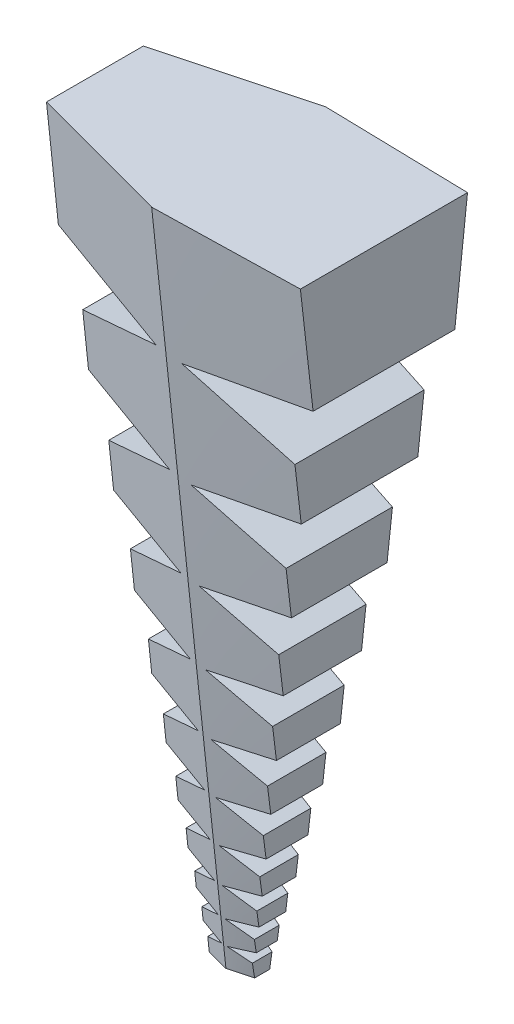
from build123d import *

# Parameters (mm, degrees)
CUT_EXTRUDE2_DEPTH      = 104.832798419
CUT_EXTRUDE2_DEPTH_BACK = 104.832798419


with BuildPart() as part:
    # Sketch2 → Loft1 section 0
    with BuildSketch(Plane(origin=(0, 0, 0), x_dir=(1, 0, 0), z_dir=(0, 1, 0))):
        with BuildLine():
            Line((0.013558001, 1.959309758), (-3.238400261, 1.087950168))
            Line((-3.238400261, 1.087950168), (-3.238400261, -1.087950168))
            Line((-3.238400261, -1.087950168), (0.013558001, -1.959309758))
            Line((0.013558001, -1.959309758), (3.265516264, -1.087950168))
            Line((3.265516264, -1.087950168), (3.265516264, 1.087950168))
            Line((3.265516264, 1.087950168), (0.013558001, 1.959309758))
        make_face()
    # Sketch3 → Loft1 section 1
    with BuildSketch(Plane(origin=(0, 100, 0), x_dir=(1, 0, 0), z_dir=(0, 1, 0))):
        with BuildLine():
            Line((-0.123443963, 12.5), (-25, 5.834346899))
            Line((-25, 5.834346899), (-25, -5.834346899))
            Line((-25, -5.834346899), (-0.123443963, -12.5))
            Line((-0.123443963, -12.5), (24.753112074, -11.920077965))
            Line((24.753112074, -11.920077965), (24.753112074, 11.920077965))
            Line((24.753112074, 11.920077965), (-0.123443963, 12.5))
        make_face()
    loft()

    # spiral_flat → Cut-Extrude2 (cut, two sides: drawn at the far end of the back side and taken through both)
    with BuildSketch(Plane.XY.offset(-CUT_EXTRUDE2_DEPTH_BACK)):
        Polygon((-20.776742097, 100), (-25, 100), (-3.265516264, 0), (-3.265516264, 2.008489475), (-0.392929297, 3.054025626), (-3.929292967, 3.677581955), (-3.929292967, 5.470777811), (-0.472799459, 6.728838563), (-4.727994587, 7.479144272), (-4.727994587, 9.636840421), (-0.568904711, 11.150625338), (-5.689047114, 12.053444588), (-5.689047114, 14.64973247), (-0.684545138, 16.471222227), (-6.84545138, 17.557556223), (-6.84545138, 20.681587736), (-0.823691624, 22.873329044), (-8.236916245, 24.180480559), (-8.236916245, 27.939529377), (-0.991122213, 30.576782728), (-9.911222133, 32.149637014), (-9.911222133, 36.672782174), (-1.192586172, 39.846106147), (-11.925861724, 41.738672218), (-11.925861724, 47.181230462), (-1.435001415, 50.999591347), (-14.35001415, 53.276856548), (-14.35001415, 59.825715627), (-1.726692049, 64.420229129), (-17.266920487, 67.160390689), (-17.266920487, 75.040426751), (-2.07767421, 80.568860277), (-20.776742097, 83.866010459), align=None)
        Polygon((3.265516264, 2.008489475), (3.265516264, 0), (25, 100), (20.776742097, 100), (20.776742097, 83.866010459), (2.07767421, 80.568860277), (17.266920487, 75.040426751), (17.266920487, 67.160390689), (1.726692049, 64.420229129), (14.35001415, 59.825715627), (14.35001415, 53.276856548), (1.435001415, 50.999591347), (11.925861724, 47.181230462), (11.925861724, 41.738672218), (1.192586172, 39.846106147), (9.911222133, 36.672782174), (9.911222133, 32.149637014), (0.991122213, 30.576782728), (8.236916245, 27.939529377), (8.236916245, 24.180480559), (0.823691624, 22.873329044), (6.84545138, 20.681587736), (6.84545138, 17.557556223), (0.684545138, 16.471222227), (5.689047114, 14.64973247), (5.689047114, 12.053444588), (0.568904711, 11.150625338), (4.727994587, 9.636840421), (4.727994587, 7.479144272), (0.472799459, 6.728838563), (3.929292967, 5.470777811), (3.929292967, 3.677581955), (0.392929297, 3.054025626), align=None)
    extrude(amount=CUT_EXTRUDE2_DEPTH + CUT_EXTRUDE2_DEPTH_BACK, mode=Mode.SUBTRACT)


solid = part.part
